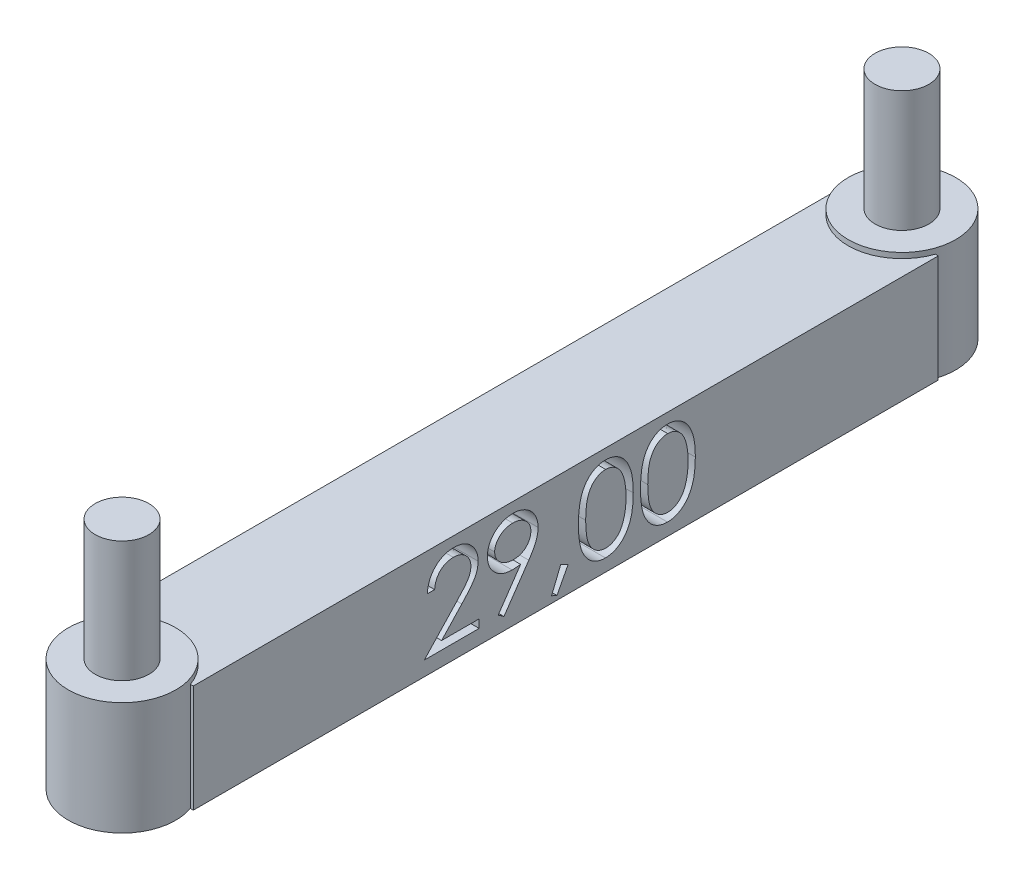
from build123d import *

# Parameters (mm, degrees)
SKIZZE1_W                            = 4
SKIZZE1_H                            = 4
AUFSATZ_LINEAR_AUSTRAGEN1_DEPTH      = 27.7
AUFSATZ_LINEAR_AUSTRAGEN2_DEPTH      = 0.2
AUFSATZ_LINEAR_AUSTRAGEN2_DEPTH_BACK = 4
AUFSATZ_LINEAR_AUSTRAGEN2_START      = 2
SKIZZE2_R                            = 2
SKIZZE3_R                            = 1
AUFSATZ_LINEAR_AUSTRAGEN4_DEPTH      = 4.5
SCHNITT_LINEAR_AUSTRAGEN2_DEPTH      = 1


with BuildPart() as part:
    # Skizze1 → Aufsatz-Linear austragen1 (new body)
    with BuildSketch(Plane.XY):
        Rectangle(SKIZZE1_W, SKIZZE1_H)
    extrude(amount=AUFSATZ_LINEAR_AUSTRAGEN1_DEPTH)

    # Skizze2 → Aufsatz-Linear austragen2 (add, two sides: drawn at the far end of the back side and taken through both)
    with BuildSketch(Plane(origin=(0, 0, 0), x_dir=(1, 0, 0), z_dir=(0, 1, 0)).offset(AUFSATZ_LINEAR_AUSTRAGEN2_START - AUFSATZ_LINEAR_AUSTRAGEN2_DEPTH_BACK)):
        with Locations((0, -28.35)):
            Circle(SKIZZE2_R)
        with Locations((0, 0.65)):
            Circle(SKIZZE2_R)
    extrude(amount=AUFSATZ_LINEAR_AUSTRAGEN2_DEPTH + AUFSATZ_LINEAR_AUSTRAGEN2_DEPTH_BACK)

    # Skizze3 → Aufsatz-Linear austragen4 (add)
    with BuildSketch(Plane(origin=(0, 2.2, 0), x_dir=(1, 0, 0), z_dir=(0, 1, 0))):
        with Locations((0, -28.35)):
            Circle(SKIZZE3_R)
        with Locations((0, 0.65)):
            Circle(SKIZZE3_R)
    extrude(amount=AUFSATZ_LINEAR_AUSTRAGEN4_DEPTH)

    # Skizze4 → Schnitt-Linear austragen2 (cut)
    # profile 1 of 5: a face of its own
    with BuildSketch(Plane(origin=(2, 0, 0), x_dir=(0, 0, -1), z_dir=(1, 0, 0))):
        with BuildLine():
            Line((-18.72561599, 0.616837358), (-18.994846759, 0.616837358))
            add(Edge.make_bspline(
                [(-18.994846759, 0.616837358), (-18.993092057, 0.652555261), (-18.989645867, 0.722704274), (-18.973507334, 0.824981908), (-18.950415153, 0.922743164), (-18.917765336, 1.01520309), (-18.877217098, 1.103179211), (-18.82859136, 1.186322081), (-18.770996631, 1.264314529), (-18.705676573, 1.336433537), (-18.634732025, 1.402594312), (-18.558184077, 1.459727378), (-18.477745482, 1.507999667), (-18.393660283, 1.548355018), (-18.3049798, 1.578646314), (-18.212508779, 1.601122005), (-18.115840948, 1.614644587), (-18.049978072, 1.616098118), (-18.016481375, 1.616837358)],
                knots=[0, 0, 0, 0, 1.10065271, 2.161652631, 3.183658789, 4.190468796, 5.17591951, 6.163126047, 7.15150782, 8.156236427, 9.156009102, 10.134482811, 11.092018607, 12.041330605, 13.001268258, 13.972401359, 14.968799086, 16, 16, 16, 16], degree=3))
            add(Edge.make_bspline(
                [(-18.016481375, 1.616837358), (-17.983585883, 1.616067252), (-17.918947416, 1.614554022), (-17.824608546, 1.601558854), (-17.734799437, 1.58120549), (-17.649695637, 1.552649419), (-17.569976153, 1.514262767), (-17.495042115, 1.468150591), (-17.42400142, 1.414819307), (-17.360052748, 1.352030324), (-17.301331537, 1.284999709), (-17.250672461, 1.213438648), (-17.20728975, 1.139527832), (-17.171128881, 1.062703659), (-17.144509334, 0.982242778), (-17.124299441, 0.899316604), (-17.112875944, 0.813066766), (-17.111122724, 0.754689718), (-17.110231375, 0.725010435)],
                knots=[0, 0, 0, 0, 1.111607364, 2.184268762, 3.212621178, 4.221274766, 5.211760367, 6.196651075, 7.1921475, 8.207485113, 9.220403448, 10.201281604, 11.166441695, 12.114753415, 13.065576456, 14.026450734, 14.996634279, 16, 16, 16, 16], degree=3))
            add(Edge.make_bspline(
                [(-17.110231375, 0.725010435), (-17.111682743, 0.683226576), (-17.11456001, 0.600392108), (-17.139172332, 0.478665082), (-17.177612199, 0.360727866), (-17.223895648, 0.265810178), (-17.270586314, 0.189324327), (-17.312661321, 0.126351151), (-17.361916873, 0.058546464), (-17.419069871, -0.013862682), (-17.482938047, -0.091443458), (-17.554099902, -0.174148997), (-17.633062886, -0.2611248), (-17.688484458, -0.320529601), (-17.717202528, -0.351311681)],
                knots=[0, 0, 0, 0, 1.184426356, 2.348067706, 3.509069118, 4.696110526, 5.333549288, 6.050745305, 6.844228056, 7.710549037, 8.667450064, 9.695053472, 10.805634456, 12, 12, 12, 12], degree=3))
            Line((-17.717202528, -0.351311681), (-18.46780349, -1.152393412))
            Line((-18.46780349, -1.152393412), (-17.071769836, -1.152393412))
            Line((-17.071769836, -1.152393412), (-17.071769836, -1.460085719))
            Line((-17.071769836, -1.460085719), (-19.110231375, -1.460085719))
            Line((-19.110231375, -1.460085719), (-17.946769836, -0.218499181))
            add(Edge.make_bspline(
                [(-17.946769836, -0.218499181), (-17.918443076, -0.188929204), (-17.864033167, -0.132131329), (-17.787076673, -0.049208792), (-17.71795754, 0.027719386), (-17.656228346, 0.098507856), (-17.603228199, 0.164192057), (-17.556194857, 0.22264466), (-17.518510065, 0.276434189), (-17.477611154, 0.338783286), (-17.43799917, 0.414908129), (-17.403960008, 0.507937006), (-17.383204423, 0.603703223), (-17.380714564, 0.668419254), (-17.379462144, 0.700971973)],
                knots=[0, 0, 0, 0, 1.329631726, 2.553950428, 3.673215718, 4.687767853, 5.603093632, 6.413772471, 7.123043292, 7.734684054, 8.834405432, 9.900288307, 10.943827018, 12, 12, 12, 12], degree=3))
            add(Edge.make_bspline(
                [(-17.379462144, 0.700971973), (-17.380007066, 0.721441743), (-17.381081002, 0.761783729), (-17.390559029, 0.820931523), (-17.40488232, 0.877987077), (-17.425406827, 0.933125894), (-17.452498318, 0.985793595), (-17.485475501, 1.036054293), (-17.523524127, 1.084644834), (-17.5675395, 1.130204804), (-17.615892232, 1.171931552), (-17.666973017, 1.208895053), (-17.721015964, 1.23978572), (-17.777793211, 1.265108717), (-17.837146471, 1.28497333), (-17.899190538, 1.298737827), (-17.96375398, 1.307379956), (-18.007839834, 1.308549246), (-18.03030349, 1.30914505)],
                knots=[0, 0, 0, 0, 0.991446411, 1.95395049, 2.89581595, 3.838931463, 4.798493298, 5.75982156, 6.748411868, 7.785213223, 8.824556874, 9.840280684, 10.836137867, 11.835679398, 12.848801643, 13.863922112, 14.911575587, 16, 16, 16, 16], degree=3))
            add(Edge.make_bspline(
                [(-18.03030349, 1.30914505), (-18.053764204, 1.308532165), (-18.099837172, 1.307328561), (-18.167482057, 1.298909134), (-18.232012724, 1.284384128), (-18.293591498, 1.264518407), (-18.352322571, 1.239268223), (-18.407920323, 1.207818156), (-18.460259943, 1.170289447), (-18.50943982, 1.127740399), (-18.554751802, 1.08036817), (-18.59456341, 1.02755963), (-18.629349708, 0.970278988), (-18.659700479, 0.908680802), (-18.684348214, 0.842206133), (-18.703182342, 0.771090958), (-18.718085354, 0.695644059), (-18.723064086, 0.643542558), (-18.72561599, 0.616837358)],
                knots=[0, 0, 0, 0, 1.031018746, 2.02475058, 2.990194455, 3.934040569, 4.864654155, 5.795059489, 6.735614925, 7.690564532, 8.649604399, 9.611025574, 10.590972636, 11.591080095, 12.624614302, 13.701020113, 14.821632451, 16, 16, 16, 16], degree=3))
        make_face()
    # profile 2 of 5: a face of its own
    with BuildSketch(Plane(origin=(2, 0, 0), x_dir=(0, 0, -1), z_dir=(1, 0, 0))):
        with BuildLine():
            Line((-16.148692913, -1.537008796), (-16.363837144, -1.387369373))
            Line((-16.363837144, -1.387369373), (-15.529702528, -0.168018412))
            add(Edge.make_bspline(
                [(-15.529702528, -0.168018412), (-15.582923159, -0.174526752), (-15.687717548, -0.187342036), (-15.793263635, -0.189696311), (-15.845207336, -0.19085495)],
                knots=[0, 0, 0, 0, 1.015715272, 2, 2, 2, 2], degree=3))
            add(Edge.make_bspline(
                [(-15.845207336, -0.19085495), (-15.87670052, -0.190048313), (-15.938518886, -0.188464955), (-16.029403159, -0.175914834), (-16.11673364, -0.156586153), (-16.200278802, -0.127744363), (-16.280352663, -0.091900184), (-16.356780418, -0.047451315), (-16.429459181, 0.004839792), (-16.49760839, 0.064696642), (-16.55958988, 0.130420687), (-16.61480985, 0.199982667), (-16.660702248, 0.274190642), (-16.698825036, 0.35153083), (-16.727736853, 0.433114845), (-16.748790457, 0.518014331), (-16.761752475, 0.60682431), (-16.763294557, 0.667274422), (-16.764077528, 0.697967165)],
                knots=[0, 0, 0, 0, 1.060718605, 2.082097864, 3.085795603, 4.069760067, 5.054557537, 6.03741023, 7.043284206, 8.066802108, 9.088538119, 10.083643548, 11.053783639, 12.022749082, 12.983451788, 13.964007469, 14.966251758, 16, 16, 16, 16], degree=3))
            add(Edge.make_bspline(
                [(-16.764077528, 0.697967165), (-16.76259087, 0.739940296), (-16.759672861, 0.822325038), (-16.736188418, 0.94269684), (-16.69756527, 1.056513877), (-16.643712376, 1.1634769), (-16.575882614, 1.262047248), (-16.494360966, 1.350854628), (-16.399643282, 1.428635931), (-16.293887266, 1.495496569), (-16.179584676, 1.549269423), (-16.059868684, 1.58890311), (-15.935656581, 1.612216322), (-15.851512864, 1.615289917), (-15.809149644, 1.616837358)],
                knots=[0, 0, 0, 0, 1.022988612, 2.007919123, 2.978103895, 3.94594894, 4.918897164, 5.887013414, 6.875921846, 7.89917871, 8.930658928, 9.948724884, 10.967259574, 12, 12, 12, 12], degree=3))
            add(Edge.make_bspline(
                [(-15.809149644, 1.616837358), (-15.767588141, 1.615268647), (-15.68546653, 1.612169021), (-15.564704524, 1.589468476), (-15.449040795, 1.551208471), (-15.339116521, 1.498335988), (-15.237339882, 1.432060924), (-15.145817758, 1.353088475), (-15.066638725, 1.261369452), (-14.999932541, 1.159122174), (-14.946386792, 1.049264762), (-14.907753407, 0.934592828), (-14.883971431, 0.815931067), (-14.880974579, 0.735535804), (-14.879462144, 0.694962358)],
                knots=[0, 0, 0, 0, 1.026385292, 2.028040595, 3.023318987, 4.028184125, 5.03290303, 6.015178782, 7.004435299, 8.016004309, 9.023023918, 10.015172535, 10.998308025, 12, 12, 12, 12], degree=3))
            add(Edge.make_bspline(
                [(-14.879462144, 0.694962358), (-14.880472209, 0.6634677), (-14.882520872, 0.599588665), (-14.896866278, 0.502534086), (-14.921226437, 0.403575889), (-14.94887075, 0.319814521), (-14.975555466, 0.25063585), (-15.000670721, 0.195991639), (-15.028538281, 0.13847627), (-15.06104008, 0.078692838), (-15.095979192, 0.015879236), (-15.135458572, -0.04933452), (-15.178577633, -0.117035943), (-15.209288822, -0.162676304), (-15.225015028, -0.186047258)],
                knots=[0, 0, 0, 0, 1.179839688, 2.393009684, 3.667231171, 4.993948276, 5.694988576, 6.444077775, 7.246288328, 8.089075292, 8.993003841, 9.939041771, 10.944649915, 12, 12, 12, 12], degree=3))
            Line((-15.225015028, -0.186047258), (-16.148692913, -1.537008796))
        make_face()
        with BuildLine():
            add(Edge.make_bspline(
                [(-15.795327528, 0.116837358), (-15.771469802, 0.117489115), (-15.725026919, 0.118757866), (-15.656989235, 0.126480073), (-15.592768489, 0.140172061), (-15.532193132, 0.159817528), (-15.474655788, 0.183523245), (-15.421070364, 0.213704947), (-15.371392013, 0.249719205), (-15.325288076, 0.290184933), (-15.284347505, 0.335142576), (-15.24788205, 0.382197239), (-15.216887278, 0.431555476), (-15.192404469, 0.483835415), (-15.172274833, 0.537764451), (-15.15837368, 0.594211041), (-15.150672822, 0.652881099), (-15.149360044, 0.692737092), (-15.148692913, 0.712991204)],
                knots=[0, 0, 0, 0, 1.163407946, 2.26475976, 3.333800367, 4.359385343, 5.366239384, 6.363380779, 7.350133999, 8.353570782, 9.349036268, 10.310270964, 11.253520213, 12.184142, 13.120487599, 14.056272588, 15.012232024, 16, 16, 16, 16], degree=3))
            add(Edge.make_bspline(
                [(-15.148692913, 0.712991204), (-15.149266915, 0.733253774), (-15.150398057, 0.773183654), (-15.159472885, 0.831940574), (-15.175437362, 0.888249083), (-15.196857778, 0.942417452), (-15.225075124, 0.994000628), (-15.258935255, 1.043646232), (-15.299163069, 1.091039484), (-15.345450983, 1.135065756), (-15.395366314, 1.17564967), (-15.448561029, 1.211466306), (-15.504596671, 1.241484475), (-15.563131376, 1.26625502), (-15.624287104, 1.285585114), (-15.688027665, 1.299485712), (-15.754675156, 1.307175787), (-15.799916258, 1.308480268), (-15.822971759, 1.30914505)],
                knots=[0, 0, 0, 0, 0.972161553, 1.915763587, 2.844109794, 3.775983486, 4.705125789, 5.659731448, 6.655561913, 7.682237399, 8.721216875, 9.739758359, 10.754845918, 11.767244016, 12.7857855, 13.828538656, 14.893392813, 16, 16, 16, 16], degree=3))
            add(Edge.make_bspline(
                [(-15.822971759, 1.30914505), (-15.845826748, 1.308479194), (-15.890668047, 1.307172791), (-15.956723041, 1.299500329), (-16.020032613, 1.285491628), (-16.081011145, 1.266263974), (-16.139544111, 1.241482627), (-16.195577111, 1.211464733), (-16.248784268, 1.175657914), (-16.298651743, 1.135033824), (-16.34502139, 1.091244413), (-16.384557558, 1.043438616), (-16.41849518, 0.994026453), (-16.446673754, 0.942410588), (-16.468104483, 0.888250915), (-16.484066199, 0.831940078), (-16.493141769, 0.773183783), (-16.494272809, 0.733253818), (-16.494846759, 0.712991204)],
                knots=[0, 0, 0, 0, 1.099389452, 2.15699305, 3.192601482, 4.213358962, 5.227959689, 6.245255729, 7.266013209, 8.307253147, 9.336162325, 10.327954924, 11.284637477, 12.215801273, 13.149702402, 14.080068371, 15.025723358, 16, 16, 16, 16], degree=3))
            add(Edge.make_bspline(
                [(-16.494846759, 0.712991204), (-16.494327394, 0.692721319), (-16.493303111, 0.652745397), (-16.483422148, 0.594008489), (-16.466897908, 0.537704322), (-16.444767002, 0.483285431), (-16.415622782, 0.431280981), (-16.379859484, 0.381937528), (-16.337940444, 0.334695713), (-16.290426026, 0.290289532), (-16.238424745, 0.249530524), (-16.182884677, 0.213933054), (-16.12476196, 0.183870959), (-16.063851991, 0.159749772), (-16.000606162, 0.140368347), (-15.93445605, 0.126505308), (-15.865620417, 0.118831936), (-15.81898329, 0.117508596), (-15.795327528, 0.116837358)],
                knots=[0, 0, 0, 0, 0.952633368, 1.87876736, 2.791047057, 3.707742249, 4.635551637, 5.587206343, 6.568248508, 7.601284464, 8.641511608, 9.671105535, 10.699146789, 11.713763218, 12.747829548, 13.806491675, 14.887386225, 16, 16, 16, 16], degree=3))
        make_face(mode=Mode.SUBTRACT)
    # profile 3 of 5: a face of its own
    with BuildSketch(Plane(origin=(2, 0, 0), x_dir=(0, 0, -1), z_dir=(1, 0, 0))):
        Polygon((-14.039317913, -0.921624181), (-13.764077528, -1.055037642), (-14.177539067, -1.844701104), (-14.379462144, -1.756960719), align=None)
    # profile 4 of 5: a face of its own
    with BuildSketch(Plane(origin=(2, 0, 0), x_dir=(0, 0, -1), z_dir=(1, 0, 0))):
        with BuildLine():
            add(Edge.make_bspline(
                [(-13.379462144, 0.038712358), (-13.379180985, 0.086795833), (-13.378634831, 0.180198677), (-13.372559042, 0.316299798), (-13.362465891, 0.443980046), (-13.348633857, 0.563245531), (-13.331801303, 0.674127044), (-13.309330886, 0.776328264), (-13.283777055, 0.870322213), (-13.254160673, 0.956415397), (-13.220742568, 1.035767714), (-13.184370344, 1.109846458), (-13.143600521, 1.178539543), (-13.100763167, 1.242943363), (-13.054124248, 1.302003673), (-13.005010999, 1.356554526), (-12.951506534, 1.40533517), (-12.89542967, 1.449774857), (-12.8362727, 1.488731547), (-12.775721843, 1.523045323), (-12.713360324, 1.552359495), (-12.649017882, 1.57540844), (-12.583272832, 1.594446309), (-12.515895346, 1.607465407), (-12.446774177, 1.615657043), (-12.400118662, 1.616440187), (-12.376457336, 1.616837358)],
                knots=[0, 0, 0, 0, 1.646270934, 3.197905019, 4.663502075, 6.030701355, 7.308322542, 8.50163776, 9.611534131, 10.641858119, 11.616356847, 12.558055219, 13.465016945, 14.349605745, 15.204443733, 16.039544428, 16.859896111, 17.680448484, 18.487036065, 19.28249412, 20.06191084, 20.843045899, 21.620316918, 22.403196591, 23.190181807, 24, 24, 24, 24], degree=3))
            add(Edge.make_bspline(
                [(-12.376457336, 1.616837358), (-12.352598355, 1.61641923), (-12.305150347, 1.615587707), (-12.235001454, 1.607595756), (-12.166473155, 1.594334793), (-12.099857608, 1.575545387), (-12.034607619, 1.552234807), (-11.971233556, 1.523017278), (-11.909341771, 1.48900682), (-11.849915811, 1.449043497), (-11.792303283, 1.40448726), (-11.737919315, 1.354119258), (-11.686758956, 1.29844807), (-11.638180123, 1.23806933), (-11.593561039, 1.171824971), (-11.551069526, 1.100867163), (-11.513036352, 1.023954993), (-11.476406631, 0.942371735), (-11.444789213, 0.853860027), (-11.416275289, 0.758918804), (-11.393236173, 0.656426644), (-11.374045368, 0.546921291), (-11.359178314, 0.430000591), (-11.348350336, 0.305915177), (-11.342630548, 0.174583414), (-11.341553376, 0.084790972), (-11.341000605, 0.038712358)],
                knots=[0, 0, 0, 0, 0.810914788, 1.612654377, 2.396697861, 3.181598691, 3.963628158, 4.749916497, 5.551656086, 6.361998678, 7.18212741, 8.025565596, 8.878627764, 9.750805457, 10.657531673, 11.591944965, 12.560506719, 13.57287815, 14.630710178, 15.753379473, 16.941251878, 18.199788006, 19.531962791, 20.947069417, 22.433333509, 24, 24, 24, 24], degree=3))
            add(Edge.make_bspline(
                [(-11.341000605, 0.038712358), (-11.341559106, -0.007165278), (-11.342647323, -0.096555979), (-11.348286214, -0.227296815), (-11.359393613, -0.35072371), (-11.373287888, -0.467132677), (-11.392531571, -0.576039208), (-11.416193142, -0.677820164), (-11.442464847, -0.772915082), (-11.474894671, -0.860544921), (-11.510389565, -0.941932112), (-11.549008305, -1.017932525), (-11.590382442, -1.089217918), (-11.635458509, -1.155217701), (-11.683504291, -1.216399407), (-11.73554811, -1.271683084), (-11.790122898, -1.322400803), (-11.847904968, -1.367530769), (-11.908257726, -1.40703203), (-11.969936935, -1.442358188), (-12.034036978, -1.470843355), (-12.099105223, -1.495301962), (-12.166072394, -1.513988063), (-12.234855015, -1.526908511), (-12.305103217, -1.535970095), (-12.352590273, -1.536661364), (-12.376457336, -1.537008796)],
                knots=[0, 0, 0, 0, 1.561518951, 3.042555995, 4.452378317, 5.7783523, 7.031515105, 8.214008947, 9.334062868, 10.386615937, 11.391082383, 12.354592575, 13.286541444, 14.194233754, 15.072674879, 15.931287219, 16.775624067, 17.606195743, 18.42308326, 19.229000347, 20.022332153, 20.807536673, 21.593273796, 22.3848459, 23.188221202, 24, 24, 24, 24], degree=3))
            add(Edge.make_bspline(
                [(-12.376457336, -1.537008796), (-12.400118005, -1.536609063), (-12.446772227, -1.535820867), (-12.515902877, -1.52766624), (-12.583002114, -1.514555809), (-12.648401046, -1.496198719), (-12.712435202, -1.47372886), (-12.774232019, -1.444454274), (-12.834478605, -1.410739358), (-12.893014225, -1.372343282), (-12.948738934, -1.328353268), (-13.00196631, -1.279698163), (-13.051359183, -1.225163811), (-13.097331265, -1.165611305), (-13.141023341, -1.101588526), (-13.181214232, -1.032221349), (-13.21838925, -0.957784826), (-13.252369385, -0.877798045), (-13.282496811, -0.791093821), (-13.309109132, -0.69668024), (-13.330121267, -0.59372398), (-13.348106657, -0.483051951), (-13.362613272, -0.364188583), (-13.372516979, -0.237069344), (-13.378638106, -0.101773451), (-13.379182452, -0.008970787), (-13.379462144, 0.038712358)],
                knots=[0, 0, 0, 0, 0.810891512, 1.598919785, 2.382837074, 3.152667961, 3.926044502, 4.706494248, 5.493654104, 6.291793342, 7.103789334, 7.925228297, 8.761435821, 9.622817696, 10.50288917, 11.416980706, 12.369136599, 13.353924996, 14.394355917, 15.514179734, 16.714354668, 17.994756427, 19.357759367, 20.818452758, 22.365282078, 24, 24, 24, 24], degree=3))
        make_face()
        with BuildLine():
            add(Edge.make_bspline(
                [(-13.110231375, 0.039914281), (-13.110128991, -0.000156032), (-13.109930286, -0.077924642), (-13.104739257, -0.190933152), (-13.097667629, -0.296336291), (-13.088546517, -0.394267893), (-13.075001133, -0.484396476), (-13.059823886, -0.567341918), (-13.041354095, -0.642665264), (-13.019501223, -0.710883388), (-12.994610568, -0.773154018), (-12.967434114, -0.831097917), (-12.938239208, -0.885399576), (-12.905565651, -0.935571241), (-12.869981311, -0.981776524), (-12.832289946, -1.024833238), (-12.791084874, -1.06323065), (-12.734081666, -1.10928224), (-12.658827545, -1.156870069), (-12.564010012, -1.198309575), (-12.466579911, -1.22435168), (-12.400450268, -1.227663471), (-12.367442913, -1.229316488)],
                knots=[0, 0, 0, 0, 1.459021318, 2.831673884, 4.118529203, 5.306027144, 6.411944654, 7.436330062, 8.375795394, 9.233974572, 10.042671642, 10.816086306, 11.563610507, 12.285937304, 12.993564865, 13.685989202, 14.367179055, 15.041617293, 16.353048772, 17.594441528, 18.799311195, 20, 20, 20, 20], degree=3))
            add(Edge.make_bspline(
                [(-12.367442913, -1.229316488), (-12.334222052, -1.227946962), (-12.267848917, -1.225210737), (-12.170877093, -1.198811819), (-12.076736862, -1.158980785), (-12.002960913, -1.111882923), (-11.946833018, -1.06703007), (-11.906618455, -1.028788942), (-11.869708128, -0.985969628), (-11.834700635, -0.939770231), (-11.802592856, -0.889308102), (-11.773395881, -0.834825894), (-11.746753012, -0.776172313), (-11.73157383, -0.735226823), (-11.723813105, -0.71429245)],
                knots=[0, 0, 0, 0, 1.353760809, 2.704726607, 4.075137775, 5.516104923, 6.260822281, 7.007110065, 7.778089737, 8.566572457, 9.372053459, 10.217411131, 11.088608312, 12, 12, 12, 12], degree=3))
            add(Edge.make_bspline(
                [(-11.723813105, -0.71429245), (-11.714768733, -0.687524102), (-11.696404778, -0.633172875), (-11.672737543, -0.548861174), (-11.65409863, -0.460401662), (-11.63733003, -0.36832299), (-11.625884554, -0.271946104), (-11.616672142, -0.171569203), (-11.611245839, -0.067116607), (-11.610573196, 0.003850528), (-11.610231375, 0.039914281)],
                knots=[0, 0, 0, 0, 0.884706709, 1.796334032, 2.740027952, 3.714592787, 4.726048262, 5.777819803, 6.87074269, 8, 8, 8, 8], degree=3))
            add(Edge.make_bspline(
                [(-11.610231375, 0.039914281), (-11.610702965, 0.0759722), (-11.611625498, 0.146509198), (-11.615151773, 0.249810496), (-11.624257694, 0.34792572), (-11.634371224, 0.441277554), (-11.649283128, 0.529349242), (-11.665361248, 0.612878075), (-11.686962287, 0.690829239), (-11.71003638, 0.764423166), (-11.736445291, 0.832823727), (-11.76551592, 0.89634983), (-11.796563142, 0.955308165), (-11.830285062, 1.009536972), (-11.866281362, 1.059279152), (-11.905502119, 1.103537376), (-11.946391581, 1.143683348), (-12.003663454, 1.189508408), (-12.078641417, 1.236232718), (-12.171937686, 1.279231941), (-12.26902681, 1.303924763), (-12.334661199, 1.307406209), (-12.367442913, 1.30914505)],
                knots=[0, 0, 0, 0, 1.31362396, 2.569729283, 3.763502607, 4.902122613, 5.988968491, 7.01645872, 7.998833611, 8.933434873, 9.825090667, 10.667526885, 11.477055099, 12.250526234, 12.991942729, 13.710640831, 14.402115721, 15.076753259, 16.378508321, 17.609869233, 18.806226677, 20, 20, 20, 20], degree=3))
            add(Edge.make_bspline(
                [(-12.367442913, 1.30914505), (-12.400623421, 1.30740381), (-12.467044883, 1.303918158), (-12.565143129, 1.279323941), (-12.659175431, 1.236455684), (-12.733955123, 1.189353651), (-12.79126694, 1.144492241), (-12.831623535, 1.105589566), (-12.869463111, 1.063035633), (-12.90432114, 1.016405421), (-12.936969097, 0.966292249), (-12.966952822, 0.912301879), (-12.993967676, 0.85416071), (-13.018897278, 0.791918051), (-13.040816811, 0.723705813), (-13.058897351, 0.648475247), (-13.075600539, 0.565793625), (-13.087425055, 0.475176904), (-13.097936846, 0.377220773), (-13.104692287, 0.2715545), (-13.109947651, 0.15835646), (-13.110134906, 0.080185752), (-13.110231375, 0.039914281)],
                knots=[0, 0, 0, 0, 1.207732386, 2.417664972, 3.655092373, 4.956220595, 5.625982001, 6.301752483, 6.994047911, 7.697131622, 8.419323945, 9.170223765, 9.943494443, 10.752040957, 11.610060368, 12.549350801, 13.567764191, 14.679664412, 15.874934091, 17.154273443, 18.533957287, 20, 20, 20, 20], degree=3))
        make_face(mode=Mode.SUBTRACT)
    # profile 5 of 5: a face of its own
    with BuildSketch(Plane(origin=(2, 0, 0), x_dir=(0, 0, -1), z_dir=(1, 0, 0))):
        with BuildLine():
            add(Edge.make_bspline(
                [(-11.071769836, 0.038712358), (-11.071488678, 0.086795833), (-11.070942523, 0.180198677), (-11.064866734, 0.316299798), (-11.054773584, 0.443980046), (-11.04094155, 0.563245531), (-11.024108995, 0.674127044), (-11.001638578, 0.776328264), (-10.976084747, 0.870322213), (-10.946468365, 0.956415397), (-10.91305026, 1.035767714), (-10.876678037, 1.109846458), (-10.835908213, 1.178539543), (-10.793070859, 1.242943363), (-10.746431941, 1.302003673), (-10.697318692, 1.356554526), (-10.643814226, 1.40533517), (-10.587737362, 1.449774857), (-10.528580392, 1.488731547), (-10.468029536, 1.523045323), (-10.405668016, 1.552359495), (-10.341325574, 1.57540844), (-10.275580524, 1.594446309), (-10.208203039, 1.607465407), (-10.13908187, 1.615657043), (-10.092426354, 1.616440187), (-10.068765028, 1.616837358)],
                knots=[0, 0, 0, 0, 1.646270934, 3.197905019, 4.663502075, 6.030701355, 7.308322542, 8.50163776, 9.611534131, 10.641858119, 11.616356847, 12.558055219, 13.465016945, 14.349605745, 15.204443733, 16.039544428, 16.859896111, 17.680448484, 18.487036065, 19.28249412, 20.06191084, 20.843045899, 21.620316918, 22.403196591, 23.190181807, 24, 24, 24, 24], degree=3))
            add(Edge.make_bspline(
                [(-10.068765028, 1.616837358), (-10.044906047, 1.61641923), (-9.997458039, 1.615587707), (-9.927309146, 1.607595756), (-9.858780848, 1.594334793), (-9.7921653, 1.575545387), (-9.726915312, 1.552234807), (-9.663541248, 1.523017278), (-9.601649464, 1.48900682), (-9.542223503, 1.449043497), (-9.484610976, 1.40448726), (-9.430227007, 1.354119258), (-9.379066648, 1.29844807), (-9.330487815, 1.23806933), (-9.285868731, 1.171824971), (-9.243377218, 1.100867163), (-9.205344045, 1.023954993), (-9.168714323, 0.942371735), (-9.137096906, 0.853860027), (-9.108582981, 0.758918804), (-9.085543865, 0.656426644), (-9.06635306, 0.546921291), (-9.051486007, 0.430000591), (-9.040658028, 0.305915177), (-9.034938241, 0.174583414), (-9.033861068, 0.084790972), (-9.033308298, 0.038712358)],
                knots=[0, 0, 0, 0, 0.810914788, 1.612654377, 2.396697861, 3.181598691, 3.963628158, 4.749916497, 5.551656086, 6.361998678, 7.18212741, 8.025565596, 8.878627764, 9.750805457, 10.657531673, 11.591944965, 12.560506719, 13.57287815, 14.630710178, 15.753379473, 16.941251878, 18.199788006, 19.531962791, 20.947069417, 22.433333509, 24, 24, 24, 24], degree=3))
            add(Edge.make_bspline(
                [(-9.033308298, 0.038712358), (-9.033866799, -0.007165278), (-9.034955015, -0.096555979), (-9.040593907, -0.227296815), (-9.051701305, -0.35072371), (-9.065595581, -0.467132677), (-9.084839263, -0.576039208), (-9.108500834, -0.677820164), (-9.134772539, -0.772915082), (-9.167202363, -0.860544921), (-9.202697258, -0.941932112), (-9.241315997, -1.017932525), (-9.282690134, -1.089217918), (-9.327766201, -1.155217701), (-9.375811984, -1.216399407), (-9.427855803, -1.271683084), (-9.48243059, -1.322400803), (-9.540212661, -1.367530769), (-9.600565419, -1.40703203), (-9.662244628, -1.442358188), (-9.72634467, -1.470843355), (-9.791412916, -1.495301962), (-9.858380087, -1.513988063), (-9.927162707, -1.526908511), (-9.997410909, -1.535970095), (-10.044897965, -1.536661364), (-10.068765028, -1.537008796)],
                knots=[0, 0, 0, 0, 1.561518951, 3.042555995, 4.452378317, 5.7783523, 7.031515105, 8.214008947, 9.334062868, 10.386615937, 11.391082383, 12.354592575, 13.286541444, 14.194233754, 15.072674879, 15.931287219, 16.775624067, 17.606195743, 18.42308326, 19.229000347, 20.022332153, 20.807536673, 21.593273796, 22.3848459, 23.188221202, 24, 24, 24, 24], degree=3))
            add(Edge.make_bspline(
                [(-10.068765028, -1.537008796), (-10.092425698, -1.536609063), (-10.139079919, -1.535820867), (-10.208210569, -1.52766624), (-10.275309806, -1.514555809), (-10.340708738, -1.496198719), (-10.404742894, -1.47372886), (-10.466539711, -1.444454274), (-10.526786297, -1.410739358), (-10.585321917, -1.372343282), (-10.641046626, -1.328353268), (-10.694274002, -1.279698163), (-10.743666876, -1.225163811), (-10.789638958, -1.165611305), (-10.833331033, -1.101588526), (-10.873521925, -1.032221349), (-10.910696943, -0.957784826), (-10.944677077, -0.877798045), (-10.974804503, -0.791093821), (-11.001416825, -0.69668024), (-11.022428959, -0.59372398), (-11.04041435, -0.483051951), (-11.054920964, -0.364188583), (-11.064824671, -0.237069344), (-11.070945798, -0.101773451), (-11.071490144, -0.008970787), (-11.071769836, 0.038712358)],
                knots=[0, 0, 0, 0, 0.810891512, 1.598919785, 2.382837074, 3.152667961, 3.926044502, 4.706494248, 5.493654104, 6.291793342, 7.103789334, 7.925228297, 8.761435821, 9.622817696, 10.50288917, 11.416980706, 12.369136599, 13.353924996, 14.394355917, 15.514179734, 16.714354668, 17.994756427, 19.357759367, 20.818452758, 22.365282078, 24, 24, 24, 24], degree=3))
        make_face()
        with BuildLine():
            add(Edge.make_bspline(
                [(-10.802539067, 0.039914281), (-10.802436684, -0.000156032), (-10.802237978, -0.077924642), (-10.797046949, -0.190933152), (-10.789975322, -0.296336291), (-10.78085421, -0.394267893), (-10.767308825, -0.484396476), (-10.752131579, -0.567341918), (-10.733661787, -0.642665264), (-10.711808915, -0.710883388), (-10.68691826, -0.773154018), (-10.659741806, -0.831097917), (-10.630546901, -0.885399576), (-10.597873343, -0.935571241), (-10.562289003, -0.981776524), (-10.524597638, -1.024833238), (-10.483392566, -1.06323065), (-10.426389358, -1.10928224), (-10.351135237, -1.156870069), (-10.256317704, -1.198309575), (-10.158887603, -1.22435168), (-10.09275796, -1.227663471), (-10.059750605, -1.229316488)],
                knots=[0, 0, 0, 0, 1.459021318, 2.831673884, 4.118529203, 5.306027144, 6.411944654, 7.436330062, 8.375795394, 9.233974572, 10.042671642, 10.816086306, 11.563610507, 12.285937304, 12.993564865, 13.685989202, 14.367179055, 15.041617293, 16.353048772, 17.594441528, 18.799311195, 20, 20, 20, 20], degree=3))
            add(Edge.make_bspline(
                [(-10.059750605, -1.229316488), (-10.026529744, -1.227946962), (-9.96015661, -1.225210737), (-9.863184785, -1.198811819), (-9.769044554, -1.158980785), (-9.695268605, -1.111882923), (-9.639140711, -1.06703007), (-9.598926148, -1.028788942), (-9.56201582, -0.985969628), (-9.527008328, -0.939770231), (-9.494900549, -0.889308102), (-9.465703573, -0.834825894), (-9.439060704, -0.776172313), (-9.423881522, -0.735226823), (-9.416120798, -0.71429245)],
                knots=[0, 0, 0, 0, 1.353760809, 2.704726607, 4.075137775, 5.516104923, 6.260822281, 7.007110065, 7.778089737, 8.566572457, 9.372053459, 10.217411131, 11.088608312, 12, 12, 12, 12], degree=3))
            add(Edge.make_bspline(
                [(-9.416120798, -0.71429245), (-9.407076425, -0.687524102), (-9.388712471, -0.633172875), (-9.365045235, -0.548861174), (-9.346406322, -0.460401662), (-9.329637723, -0.36832299), (-9.318192246, -0.271946104), (-9.308979835, -0.171569203), (-9.303553532, -0.067116607), (-9.302880888, 0.003850528), (-9.302539067, 0.039914281)],
                knots=[0, 0, 0, 0, 0.884706709, 1.796334032, 2.740027952, 3.714592787, 4.726048262, 5.777819803, 6.87074269, 8, 8, 8, 8], degree=3))
            add(Edge.make_bspline(
                [(-9.302539067, 0.039914281), (-9.303010658, 0.0759722), (-9.30393319, 0.146509198), (-9.307459465, 0.249810496), (-9.316565386, 0.34792572), (-9.326678917, 0.441277554), (-9.34159082, 0.529349242), (-9.357668941, 0.612878075), (-9.37926998, 0.690829239), (-9.402344073, 0.764423166), (-9.428752983, 0.832823727), (-9.457823612, 0.89634983), (-9.488870834, 0.955308165), (-9.522592755, 1.009536972), (-9.558589054, 1.059279152), (-9.597809811, 1.103537376), (-9.638699273, 1.143683348), (-9.695971147, 1.189508408), (-9.770949109, 1.236232718), (-9.864245379, 1.279231941), (-9.961334502, 1.303924763), (-10.026968892, 1.307406209), (-10.059750605, 1.30914505)],
                knots=[0, 0, 0, 0, 1.31362396, 2.569729283, 3.763502607, 4.902122613, 5.988968491, 7.01645872, 7.998833611, 8.933434873, 9.825090667, 10.667526885, 11.477055099, 12.250526234, 12.991942729, 13.710640831, 14.402115721, 15.076753259, 16.378508321, 17.609869233, 18.806226677, 20, 20, 20, 20], degree=3))
            add(Edge.make_bspline(
                [(-10.059750605, 1.30914505), (-10.092931113, 1.30740381), (-10.159352575, 1.303918158), (-10.257450822, 1.279323941), (-10.351483123, 1.236455684), (-10.426262816, 1.189353651), (-10.483574633, 1.144492241), (-10.523931227, 1.105589566), (-10.561770803, 1.063035633), (-10.596628832, 1.016405421), (-10.629276789, 0.966292249), (-10.659260514, 0.912301879), (-10.686275368, 0.85416071), (-10.71120497, 0.791918051), (-10.733124503, 0.723705813), (-10.751205043, 0.648475247), (-10.767908231, 0.565793625), (-10.779732748, 0.475176904), (-10.790244538, 0.377220773), (-10.796999979, 0.2715545), (-10.802255343, 0.15835646), (-10.802442598, 0.080185752), (-10.802539067, 0.039914281)],
                knots=[0, 0, 0, 0, 1.207732386, 2.417664972, 3.655092373, 4.956220595, 5.625982001, 6.301752483, 6.994047911, 7.697131622, 8.419323945, 9.170223765, 9.943494443, 10.752040957, 11.610060368, 12.549350801, 13.567764191, 14.679664412, 15.874934091, 17.154273443, 18.533957287, 20, 20, 20, 20], degree=3))
        make_face(mode=Mode.SUBTRACT)
    extrude(amount=-SCHNITT_LINEAR_AUSTRAGEN2_DEPTH, mode=Mode.SUBTRACT)


solid = part.part
